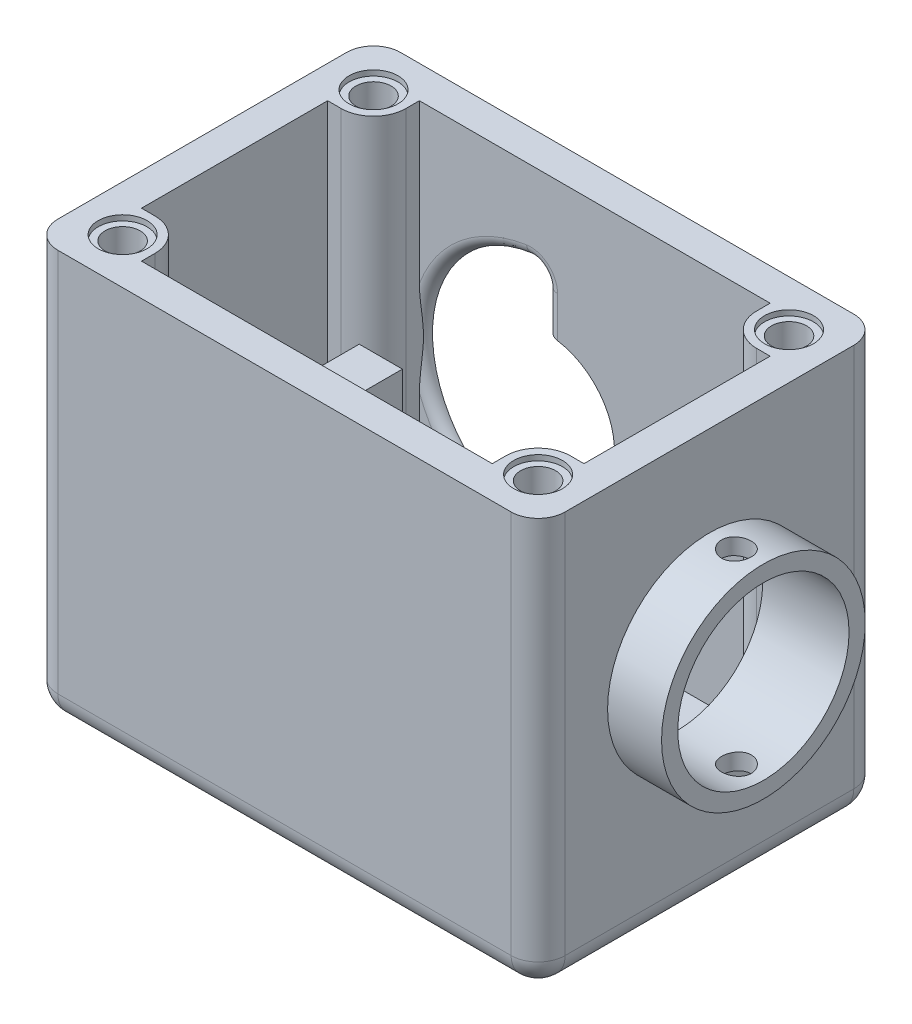
from build123d import *

# Parameters (mm, degrees)
SKETCH1_W                               = 94
SKETCH1_H                               = 63.5
BOSS_EXTRUDE1_DEPTH                     = 76.2
SKETCH2_W                               = 82.000024
SKETCH2_H                               = 51.500024
CUT_EXTRUDE1_DEPTH                      = 70.2
SKETCH7_R                               = 31.95
CUT_EXTRUDE4_DEPTH                      = 4
SKETCH8_R                               = 12.55
CUT_EXTRUDE5_DEPTH                      = 2
SKETCH14_W                              = 8
SKETCH14_H                              = 9.3
BOSS_EXTRUDE2_DEPTH                     = 42.2
BOSS_EXTRUDE3_DEPTH                     = 22
F_1_0MM_DOWEL_HOLE1_D                   = 3.4
F_1_0MM_DOWEL_HOLE1_DEPTH               = 10.5
F_1_0MM_DOWEL_HOLE1_TIP                 = 1.021463052
F_1_0MM_DOWEL_HOLE2_D                   = 4
F_1_0MM_DOWEL_HOLE2_DEPTH               = 5.3
F_1_0MM_DOWEL_HOLE2_TIP                 = 1.201721238
FILLET1_R                               = 5
BOSS_EXTRUDE4_DEPTH                     = 70.2
CBORE_FOR_M5_HEX_HEAD_BOLT1_D           = 6.5
CBORE_FOR_M5_HEX_HEAD_BOLT1_DEPTH       = 10.75
CBORE_FOR_M5_HEX_HEAD_BOLT1_CBORE_D     = 9.05
CBORE_FOR_M5_HEX_HEAD_BOLT1_CBORE_DEPTH = 1
CBORE_FOR_M5_HEX_HEAD_BOLT1_TIP         = 1.952797012
SKETCH49_R                              = 15.875
CUT_EXTRUDE7_DEPTH                      = 5.999988
BOSS_EXTRUDE5_START                     = 10
SKETCH51_R                              = 18.875
SKETCH51_R_2                            = 15.875
BOSS_EXTRUDE5_DEPTH                     = 10
SKETCH52_R                              = 2.75
CUT_EXTRUDE8_DEPTH                      = 124.940865436
CUT_EXTRUDE9_DEPTH                      = 1.999988
FILLET2_R                               = 3
FILLET3_R                               = 2


with BuildPart() as part:
    # Sketch1 → Boss-Extrude1 (new body)
    with BuildSketch(Plane(origin=(0, 0, 0), x_dir=(1, 0, 0), z_dir=(0, 1, 0))):
        with Locations((47, 0)):
            Rectangle(SKETCH1_W, SKETCH1_H)
    extrude(amount=BOSS_EXTRUDE1_DEPTH)

    # Sketch2 → Cut-Extrude1 (cut)
    with BuildSketch(Plane(origin=(0, 76.2, 0), x_dir=(1, 0, 0), z_dir=(0, 1, 0))):
        with Locations((47, 0)):
            Rectangle(SKETCH2_W, SKETCH2_H)
    extrude(amount=-CUT_EXTRUDE1_DEPTH, mode=Mode.SUBTRACT)

    # Sketch7 → Cut-Extrude4 (cut)
    with BuildSketch(Plane(origin=(0, 0, -31.75), x_dir=(-1, 0, 0), z_dir=(0, 0, -1))):
        with Locations((-38.1, 38.1)):
            Circle(SKETCH7_R)
    extrude(amount=-CUT_EXTRUDE4_DEPTH, mode=Mode.SUBTRACT)

    # Sketch8 → Cut-Extrude5 (cut)
    with BuildSketch(Plane.XY.offset(-25.750012)):
        with Locations((38.1, 38.1)):
            Circle(SKETCH8_R)
    extrude(amount=-CUT_EXTRUDE5_DEPTH, mode=Mode.SUBTRACT)

    # Sketch14 → Boss-Extrude2 (add)
    with BuildSketch(Plane(origin=(0, 6, 0), x_dir=(1, 0, 0), z_dir=(0, 1, 0))):
        with Locations((23.999988, 4.450012)):
            Rectangle(SKETCH14_W, SKETCH14_H)
        with Locations((72.499988, 4.450012)):
            Rectangle(SKETCH14_W, SKETCH14_H)
    extrude(amount=BOSS_EXTRUDE2_DEPTH)

    # Sketch15 → Boss-Extrude3 (add)
    with BuildSketch(Plane(origin=(0, 28, 0), x_dir=(1, 0, 0), z_dir=(0, 1, 0))):
        Polygon((27.999988, 9.100012), (68.499988, 9.100012), (68.499988, -0.199988), (76.499988, -0.199988), (76.499988, -11.199988), (19.999988, -11.199988), (19.999988, -0.199988), (27.999988, -0.199988), align=None)
    extrude(amount=-BOSS_EXTRUDE3_DEPTH)

    # Ø1.0mm Dowel Hole1
    with Locations(Plane(origin=(0, 28, 0), x_dir=(1, 0, 0), z_dir=(0, 1, 0))):
        with Locations((22.999988, -5.699988), (73.499988, -5.699988)):
            Hole(F_1_0MM_DOWEL_HOLE1_D / 2, depth=F_1_0MM_DOWEL_HOLE1_DEPTH)
            with Locations((0, 0, -(F_1_0MM_DOWEL_HOLE1_DEPTH + F_1_0MM_DOWEL_HOLE1_TIP / 2))):  # 118° drill point
                Cone(0, F_1_0MM_DOWEL_HOLE1_D / 2, F_1_0MM_DOWEL_HOLE1_TIP, mode=Mode.SUBTRACT)

    # Ø1.0mm Dowel Hole2
    with Locations(Plane(origin=(0, 0, -9.100012), x_dir=(-1, 0, 0), z_dir=(0, 0, -1))):
        with Locations((-72.499988, 42.43), (-72.499988, 33.72), (-23.999988, 42.43), (-23.999988, 33.72)):
            Hole(F_1_0MM_DOWEL_HOLE2_D / 2, depth=F_1_0MM_DOWEL_HOLE2_DEPTH)
            with Locations((0, 0, -(F_1_0MM_DOWEL_HOLE2_DEPTH + F_1_0MM_DOWEL_HOLE2_TIP / 2))):  # 118° drill point
                Cone(0, F_1_0MM_DOWEL_HOLE2_D / 2, F_1_0MM_DOWEL_HOLE2_TIP, mode=Mode.SUBTRACT)

    # Fillet1
    fillet1_edges = [part.edges().sort_by_distance(p)[0] for p in [
        (47, 0, -31.75),
        (94, 0, 0),
        (47, 0, 31.75),
        (0, 0, 0),
        (0, 38.1, -31.75),
        (94, 38.1, -31.75),
        (94, 38.1, 31.75),
        (0, 38.1, 31.75),
    ]]
    fillet(fillet1_edges, radius=FILLET1_R)

    # Sketch44 → Boss-Extrude4 (add)
    with BuildSketch(Plane(origin=(0, 76.2, 0), x_dir=(1, 0, 0), z_dir=(0, 1, 0))):
        with BuildLine():
            Line((8.499988, 17.250012), (5.999988, 17.250012))
            Line((5.999988, 17.250012), (5.999988, 25.750012))
            Line((5.999988, 25.750012), (14.499988, 25.750012))
            Line((14.499988, 25.750012), (14.499988, 23.250012))
            ThreePointArc((14.499988, 23.250012), (12.742628687, 19.007371313), (8.499988, 17.250012))
        make_face()
        with BuildLine():
            Line((8.499988, -17.250012), (5.999988, -17.250012))
            Line((5.999988, -17.250012), (5.999988, -25.750012))
            Line((5.999988, -25.750012), (14.499988, -25.750012))
            Line((14.499988, -25.750012), (14.499988, -23.250012))
            ThreePointArc((14.499988, -23.250012), (12.742628687, -19.007371313), (8.499988, -17.250012))
        make_face()
        with BuildLine():
            Line((79.500012, -23.250012), (79.500012, -25.750012))
            Line((79.500012, -25.750012), (88.000012, -25.750012))
            Line((88.000012, -25.750012), (88.000012, -17.250012))
            Line((88.000012, -17.250012), (85.500012, -17.250012))
            ThreePointArc((85.500012, -17.250012), (81.257371313, -19.007371313), (79.500012, -23.250012))
        make_face()
        with BuildLine():
            Line((79.500012, 23.250012), (79.500012, 25.750012))
            Line((79.500012, 25.750012), (88.000012, 25.750012))
            Line((88.000012, 25.750012), (88.000012, 17.250012))
            Line((88.000012, 17.250012), (85.500012, 17.250012))
            ThreePointArc((85.500012, 17.250012), (81.257371313, 19.007371313), (79.500012, 23.250012))
        make_face()
    extrude(amount=-BOSS_EXTRUDE4_DEPTH)

    # CBORE for M5 Hex Head Bolt1
    with Locations(Plane(origin=(0, 76.2, 0), x_dir=(1, 0, 0), z_dir=(0, 1, 0))):
        with Locations((8.499988, 23.250012), (8.499988, -23.250012), (85.500012, -23.250012), (85.500012, 23.250012)):
            CounterBoreHole(CBORE_FOR_M5_HEX_HEAD_BOLT1_D / 2, CBORE_FOR_M5_HEX_HEAD_BOLT1_CBORE_D / 2, CBORE_FOR_M5_HEX_HEAD_BOLT1_CBORE_DEPTH, depth=CBORE_FOR_M5_HEX_HEAD_BOLT1_DEPTH)
            with Locations((0, 0, -(CBORE_FOR_M5_HEX_HEAD_BOLT1_DEPTH + CBORE_FOR_M5_HEX_HEAD_BOLT1_TIP / 2))):  # 118° drill point
                Cone(0, CBORE_FOR_M5_HEX_HEAD_BOLT1_D / 2, CBORE_FOR_M5_HEX_HEAD_BOLT1_TIP, mode=Mode.SUBTRACT)

    # Sketch49 → Cut-Extrude7 (cut)
    with BuildSketch(Plane(origin=(94, 0, 0), x_dir=(0, 0, -1), z_dir=(1, 0, 0))):
        with Locations((0, 40.6)):
            Circle(SKETCH49_R)
    extrude(amount=-CUT_EXTRUDE7_DEPTH, mode=Mode.SUBTRACT)

    # Sketch51 → Boss-Extrude5 (add)
    with BuildSketch(Plane(origin=(94, 0, 0), x_dir=(0, 0, -1), z_dir=(1, 0, 0)).offset(BOSS_EXTRUDE5_START)):
        with Locations(Location((0, 40.6, 0), (0, 0, 180))):
            Circle(SKETCH51_R)
        with Locations((0, 40.6)):
            Circle(SKETCH51_R_2, mode=Mode.SUBTRACT)
    extrude(amount=-BOSS_EXTRUDE5_DEPTH)

    # Sketch52 → Cut-Extrude8 (cut, through all)
    with BuildSketch(Plane(origin=(0, 59.475, 0), x_dir=(-1, 0, 0), z_dir=(0, 1, 0))):
        with Locations(Location((-99, 0, 0), (0, 0, 90))):
            Circle(SKETCH52_R)
    extrude(amount=-CUT_EXTRUDE8_DEPTH, mode=Mode.SUBTRACT)

    # Sketch53 → Cut-Extrude9 (cut)
    with BuildSketch(Plane(origin=(0, 0, -27.75), x_dir=(-1, 0, 0), z_dir=(0, 0, -1))):
        with BuildLine():
            Line((-38.1, 61.27), (-38.1, 14.93))
            ThreePointArc((-38.1, 14.93), (-14.93, 38.1), (-38.1, 61.27))
        make_face()
    extrude(amount=-CUT_EXTRUDE9_DEPTH, mode=Mode.SUBTRACT)

    # Fillet2
    fillet2_edges = [part.edges().sort_by_distance(p)[0] for p in [
        (38.1, 14.93, -26.750006),
        (38.1, 61.27, -26.750006),
    ]]
    fillet(fillet2_edges, radius=FILLET2_R)

    # Fillet3
    # the kernel refuses this fillet: 2 mm, written as the material it takes off along each edge
    with BuildSketch(Plane(origin=(38.1, 58.045648648, -25.750012), x_dir=(0, 0, -1), z_dir=(0, -1, 0)), Plane(origin=(38.1, 30.55, -25.750012), x_dir=(0, 0, -1), z_dir=(0, -1, 0))) as fillet3_piece_1:
        with BuildLine():
            CenterArc((2, 2), FILLET3_R, 180, 89.999656225)
            Line((0, 2), (-0.04, 2))
            Line((-0.04, 2), (-0.04, 0))
            Line((-0.04, 0), (0, -0.04))
            Line((0, -0.04), (1.99998776, -0.04))
            Line((1.99998776, -0.04), (1.999988, 0))
        make_face()
    extrude(amount=12.395648648, mode=Mode.SUBTRACT)
    with BuildSketch(Plane(origin=(35.1, 58.045648648, -25.750012), x_dir=(-0.14873574615765991, 0.988876978099361, 0), z_dir=(-0.988876978099361, -0.14873574615765991, 0))) as fillet3_piece_2:
        with BuildLine():
            CenterArc((5, 2), FILLET3_R, 180.000343775, 89.999656225)
            Line((5, 0), (5, -0.04))
            Line((5, -0.04), (3, -0.04))
            Line((3, -0.04), (2.96, 0))
            Line((2.96, 0), (2.96, 1.99998776))
            Line((2.96, 1.99998776), (3, 1.999988))
        make_face()
    revolve(axis=Axis((35.1, 58.045648648, -25.750012), (0, 0, -1)), revolution_arc=98.553668311, mode=Mode.SUBTRACT)
    with BuildSketch(Plane(origin=(35.1, 18.154351352, -25.750012), x_dir=(1, 0, 0), z_dir=(0, 1, 0))) as fillet3_piece_3:
        with BuildLine():
            CenterArc((5, 2), FILLET3_R, 180.000343775, 89.999656225)
            Line((5, 0), (5, -0.04))
            Line((5, -0.04), (3, -0.04))
            Line((3, -0.04), (2.96, 0))
            Line((2.96, 0), (2.96, 1.99998776))
            Line((2.96, 1.99998776), (3, 1.999988))
        make_face()
    revolve(axis=Axis((35.1, 18.154351352, -25.750012), (0, 0, -1)), revolution_arc=98.553668311, mode=Mode.SUBTRACT)
    with BuildSketch(Plane(origin=(38.1, 38.1, -25.750012), x_dir=(-0.14873574615765983, -0.988876978099361, 0), z_dir=(0.988876978099361, -0.14873574615765983, 0))) as fillet3_piece_4_section:
        with BuildLine():
            CenterArc((25.17, 2), FILLET3_R, 180.000343775, 89.999656225)
            Line((25.17, 0), (25.17, -0.04))
            Line((25.17, -0.04), (23.17, -0.04))
            Line((23.17, -0.04), (23.13, 0))
            Line((23.13, 0), (23.13, 1.99998776))
            Line((23.13, 1.99998776), (23.17, 1.999988))
        make_face()
    fillet3_piece_4 = revolve(axis=Axis((38.1, 38.1, -25.750012), (0, 0, -1)), revolution_arc=162.892663379, mode=Mode.PRIVATE)
    fillet3_piece_4 = split(fillet3_piece_4, bisect_by=Plane(origin=(14.499988, 19.260781235, -27.221962955), z_dir=(1, 0, 0)), keep=Keep.TOP, mode=Mode.PRIVATE)
    add(fillet3_piece_4, mode=Mode.SUBTRACT)


solid = part.part
